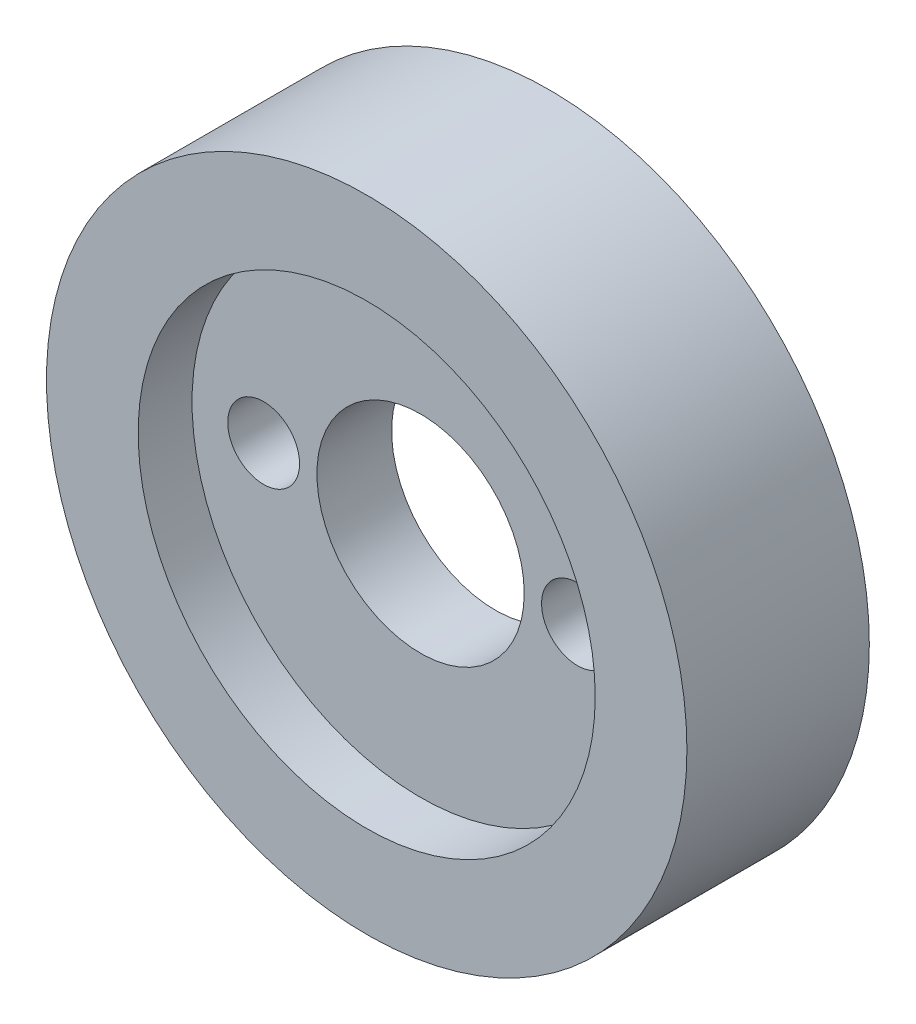
from build123d import *

# Parameters (mm, degrees)
SKETCH1_R           = 9.80909091
SKETCH1_R_2         = 3.175
BOSS_EXTRUDE1_DEPTH = 2.794
CUT_EXTRUDE1_START  = -1.65
SKETCH2_R           = 1.1
CUT_EXTRUDE1_DEPTH  = 1.65
SKETCH2_3_R         = 1.1
CUT_EXTRUDE2_DEPTH  = 15.955342623


with BuildPart() as part:
    # Sketch1 → Boss-Extrude1 (new, symmetric)
    with BuildSketch(Plane.XY):
        Circle(SKETCH1_R)
        Circle(SKETCH1_R_2, mode=Mode.SUBTRACT)
    extrude(amount=BOSS_EXTRUDE1_DEPTH, both=True)

    # Sketch2 → Cut-Extrude1 (cut)
    with BuildSketch(Plane.XY.offset(2.794).offset(CUT_EXTRUDE1_START)):
        with BuildLine():
            ThreePointArc((7, 0), (0, 7), (-7, 0))
            ThreePointArc((-7, 0), (0, -7), (7, 0))
        make_face()
        with BuildLine():
            ThreePointArc((-3.70695, 0), (-4.80695, -1.1), (-5.90695, 0))
            ThreePointArc((-5.90695, 0), (-4.80695, 1.1), (-3.70695, 0))
        make_face(mode=Mode.SUBTRACT)
        with BuildLine():
            ThreePointArc((3.175, 0), (0, -3.175), (-3.175, 0))
            ThreePointArc((-3.175, 0), (0, 3.175), (3.175, 0))
        make_face(mode=Mode.SUBTRACT)
        with Locations((4.80695, 0)):
            Circle(SKETCH2_R, mode=Mode.SUBTRACT)
    cut_extrude1 = extrude(amount=CUT_EXTRUDE1_DEPTH, mode=Mode.SUBTRACT)

    # Mirror1: Cut-Extrude1 across plane
    add(cut_extrude1.mirror(Plane.XY), mode=Mode.SUBTRACT)

    # Sketch2<3> → Cut-Extrude2 (cut, through all)
    with BuildSketch(Plane.XY.offset(2.794)):
        with Locations((-4.80695, 0)):
            Circle(SKETCH2_3_R)
        with Locations((4.80695, 0)):
            Circle(SKETCH2_3_R)
    extrude(amount=-CUT_EXTRUDE2_DEPTH, mode=Mode.SUBTRACT)


solid = part.part
